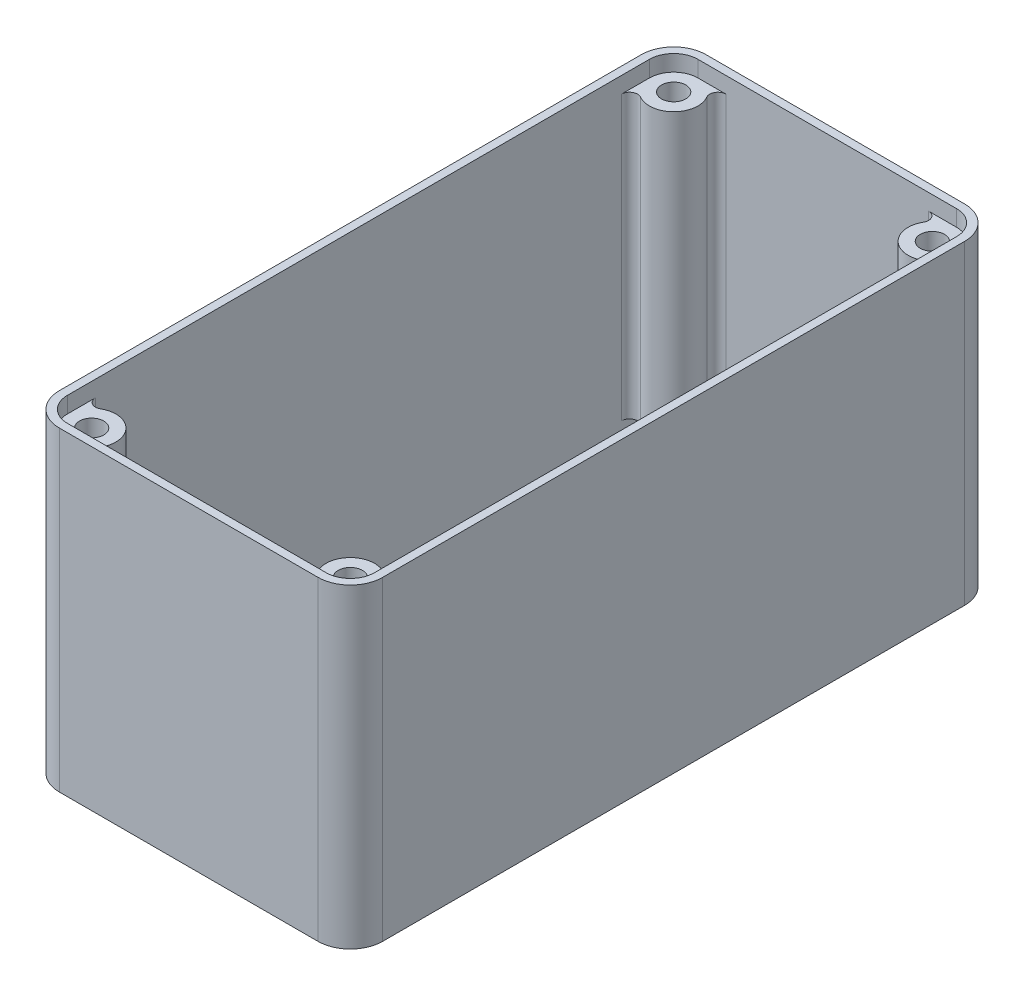
from build123d import *

# Parameters (mm, degrees)
ESQUISSE1_R             = 0.7500000000000007
BOSS_EXTRU_1_DEPTH      = 19.5
ENL_V_START             = -1
ESQUISSE2_R             = 1.5000000000042053
ESQUISSE2_R_2           = 1.5000000000000118
ESQUISSE2_R_3           = 1.5000000000000042
ESQUISSE2_R_4           = 1.4999999999999973
ENL_V_MAT_EXTRU_1_DEPTH = 1
ENL_V_START_2           = -19.5
ESQUISSE2_2_R           = 1.5000000000042053
ESQUISSE2_2_R_2         = 1.5000000000000118
ESQUISSE2_2_R_3         = 1.5000000000000042
ESQUISSE2_2_R_4         = 1.4999999999999973
ENL_V_MAT_EXTRU_2_DEPTH = 1
CONG_1_R                = 0.5
CONG_2_START            = -18.5
CONG_2_DEPTH            = 17.5


with BuildPart() as part:
    # Esquisse1 → Boss.-Extru.1 (new body)
    with BuildSketch(Plane.XZ.offset(19.5)):
        with BuildLine():
            Line((-55.9111281070707, 24.325812619498315), (-39.91112810707456, 24.325812619498663))
            ThreePointArc((-39.91112810707456, 24.325812619498663), (-38.49691454470147, 24.911599057125567), (-37.91112810707456, 26.325812619498663))
            Line((-37.91112810707456, 26.325812619498663), (-37.91112810707456, 62.32581261950286))
            ThreePointArc((-37.91112810707456, 62.32581261950286), (-38.49691454470147, 63.740026181875955), (-39.91112810707456, 64.32581261950286))
            Line((-39.91112810707456, 64.32581261950286), (-55.91112810707387, 64.32581261950355))
            ThreePointArc((-55.91112810707387, 64.32581261950355), (-57.3253416694479, 63.74002618187669), (-57.91112810707526, 62.32581261950286))
            Line((-57.91112810707526, 62.32581261950286), (-57.91112810707456, 26.325812619502862))
            ThreePointArc((-57.91112810707456, 26.325812619502862), (-57.325341669446544, 24.911599057126917), (-55.9111281070707, 24.325812619498315))
        make_face()
        with Locations(Location((-39.91112810707456, 26.325812619498663, 0), (0, 0, 90))):
            Circle(ESQUISSE1_R, mode=Mode.SUBTRACT)
        with Locations(Location((-39.91112810707456, 62.32581261950286, 0), (0, 0, 90))):
            Circle(ESQUISSE1_R, mode=Mode.SUBTRACT)
        with Locations(Location((-55.91112810707456, 62.32581261950286, 0), (0, 0, 90))):
            Circle(ESQUISSE1_R, mode=Mode.SUBTRACT)
        with Locations(Location((-55.911128107070354, 26.325812619502862, 0), (0, 0, 90))):
            Circle(ESQUISSE1_R, mode=Mode.SUBTRACT)
        with BuildLine():
            Line((-38.41112810707456, 62.32581261950286), (-38.41112810707455, 26.325812619498663))
            ThreePointArc((-38.41112810707455, 26.325812619498663), (-40.97178827885439, 27.38647279127849), (-39.91112810707456, 24.825812619498656))
            Line((-39.91112810707456, 24.825812619498656), (-55.911128107070354, 24.825812619498652))
            ThreePointArc((-55.911128107070354, 24.825812619498652), (-54.850467935287554, 27.386472791285662), (-57.41112810707456, 26.325812619502862))
            Line((-57.41112810707456, 26.325812619502862), (-57.41112810707456, 62.32581261950286))
            ThreePointArc((-57.41112810707456, 62.32581261950286), (-54.85046793529474, 61.26515244772304), (-55.91112810707456, 63.82581261950286))
            Line((-55.91112810707456, 63.82581261950286), (-39.91112810707456, 63.82581261950286))
            ThreePointArc((-39.91112810707456, 63.82581261950286), (-40.97178827885438, 61.26515244772304), (-38.41112810707456, 62.32581261950286))
        make_face(mode=Mode.SUBTRACT)
    extrude(amount=-BOSS_EXTRU_1_DEPTH)

    # Esquisse2 → Enlèv. mat.-Extru.1 (cut)
    with BuildSketch(Plane(origin=(0, 0, 0), x_dir=(1, 0, 0), z_dir=(0, 1, 0)).offset(ENL_V_START)):
        with Locations((-55.911128107070354, -26.325812619502862)):
            Circle(ESQUISSE2_R)
        with Locations((-39.91112810707456, -26.325812619498663)):
            Circle(ESQUISSE2_R_2)
        with Locations((-55.91112810707456, -62.32581261950286)):
            Circle(ESQUISSE2_R_3)
        with Locations((-39.91112810707456, -62.32581261950286)):
            Circle(ESQUISSE2_R_4)
    extrude(amount=ENL_V_MAT_EXTRU_1_DEPTH, mode=Mode.SUBTRACT)

    # Esquisse2<2> → Enlèv. mat.-Extru.2 (cut)
    with BuildSketch(Plane(origin=(0, 0, 0), x_dir=(1, 0, 0), z_dir=(0, 1, 0)).offset(ENL_V_START_2)):
        with Locations((-55.911128107070354, -26.325812619502862)):
            Circle(ESQUISSE2_2_R)
        with Locations((-39.91112810707456, -26.325812619498663)):
            Circle(ESQUISSE2_2_R_2)
        with Locations((-55.91112810707456, -62.32581261950286)):
            Circle(ESQUISSE2_2_R_3)
        with Locations((-39.91112810707456, -62.32581261950286)):
            Circle(ESQUISSE2_2_R_4)
    extrude(amount=ENL_V_MAT_EXTRU_2_DEPTH, mode=Mode.SUBTRACT)

    # Congé1
    cong_1_edges = [part.edges().sort_by_distance(p)[0] for p in [
        (-57.41112810707456, -9.75, 26.325812619502862),
        (-38.41112810707456, -9.75, 26.325812619498663),
        (-57.41112810707456, -9.75, 62.32581261950286),
        (-38.41112810707456, -9.75, 62.32581261950286),
    ]]
    fillet(cong_1_edges, radius=CONG_1_R - 0.0001)  # a hair under: the kernel refuses the full size

    # Congé2: read off the stored shape, not the designer's step
    # Congé2 outline → Congé2 (add)
    with BuildSketch(Plane(origin=(0, 0, 0), x_dir=(1, 0, 0), z_dir=(0, 1, 0)).offset(CONG_2_START)):
        with BuildLine():
            ThreePointArc((-39.911128107, -63.82581262), (-40.661128107, -63.624850726), (-41.210166213, -63.07581262))
            ThreePointArc((-41.210166213, -63.07581262), (-41.210166213, -63.57581262), (-41.643178915, -63.82581262))
            Line((-41.643178915, -63.82581262), (-39.911128107, -63.82581262))
        make_face()
        with BuildLine():
            Line((-55.911128107, -63.82581262), (-54.1790773, -63.82581262))
            ThreePointArc((-54.1790773, -63.82581262), (-54.612090001, -63.57581262), (-54.612090001, -63.07581262))
            ThreePointArc((-54.612090001, -63.07581262), (-55.161128107, -63.624850725), (-55.911128107, -63.82581262))
        make_face()
        with BuildLine():
            Line((-39.911128107, -24.825812619), (-41.643178915, -24.825812619))
            ThreePointArc((-41.643178915, -24.825812619), (-41.210166213, -25.075812619), (-41.210166213, -25.575812619))
            ThreePointArc((-41.210166213, -25.575812619), (-40.661128107, -25.026774513), (-39.911128107, -24.825812619))
        make_face()
        with BuildLine():
            ThreePointArc((-54.612090001, -25.575812619), (-54.612090001, -25.075812619), (-54.179077299, -24.825812619))
            Line((-54.179077299, -24.825812619), (-55.911128107, -24.825812619))
            ThreePointArc((-55.911128107, -24.825812619), (-55.161128107, -25.026774514), (-54.612090001, -25.575812619))
        make_face()
    extrude(amount=CONG_2_DEPTH)


solid = part.part
